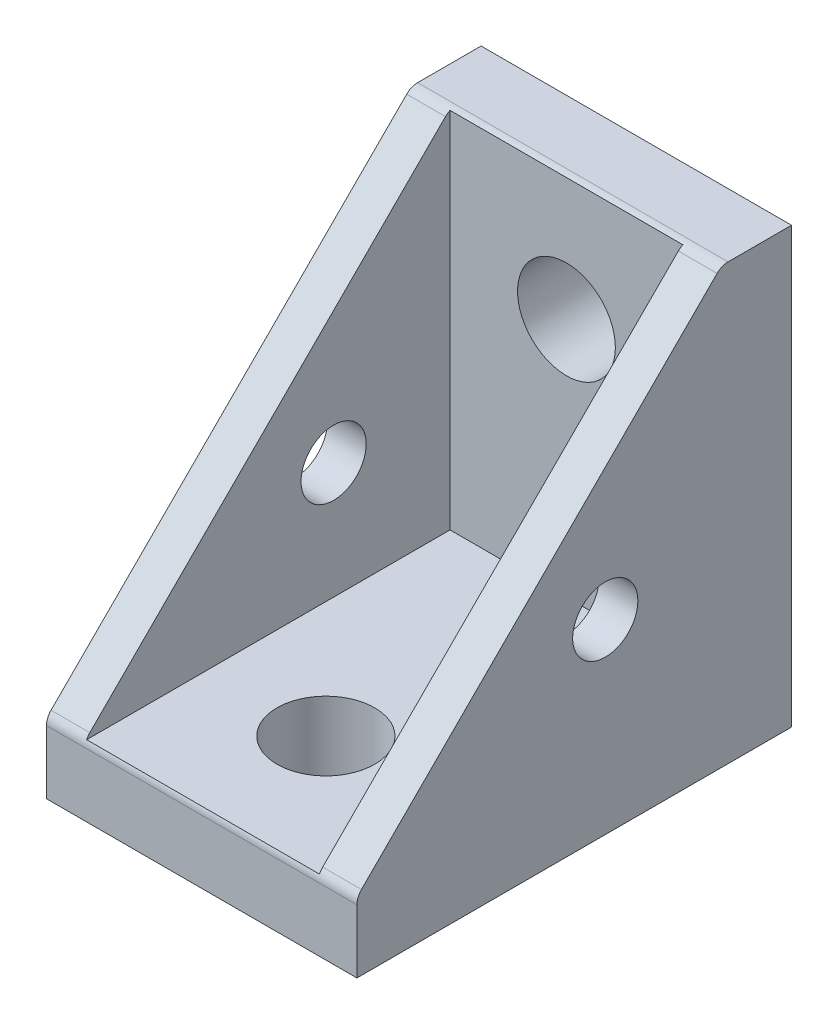
from build123d import *

# Parameters (mm, degrees)
ESTRUSIONE_ESTRUSIONE1_DEPTH = 2.5
SCHIZZO2_W                   = 15
SCHIZZO2_H                   = 23.5
ESTRUSIONE_ESTRUSIONE2_DEPTH = 23.5
SCHIZZO3_W                   = 17.5
SCHIZZO3_H                   = 23.5
ESTRUSIONE_ESTRUSIONE3_DEPTH = 4.5
SCHIZZO4_W                   = 17.5
SCHIZZO4_H                   = 28
ESTRUSIONE_ESTRUSIONE4_DEPTH = 4.5
SCHIZZO5_W                   = 15
SCHIZZO5_H                   = 23.5
TAGLIO_ESTRUSIONE1_DEPTH     = 23.5
ESTRUSIONE_ESTRUSIONE5_DEPTH = 2.5
SCHIZZO7_W                   = 8
SCHIZZO7_H                   = 2
ESTRUSIONE_ESTRUSIONE6_DEPTH = 1
SCHIZZO8_W                   = 8
SCHIZZO8_H                   = 2
ESTRUSIONE_ESTRUSIONE7_DEPTH = 1
SCHIZZO9_W                   = 8
SCHIZZO9_H                   = 2
ESTRUSIONE_ESTRUSIONE8_DEPTH = 1
SCHIZZO10_W                  = 8
SCHIZZO10_H                  = 2
ESTRUSIONE_ESTRUSIONE9_DEPTH = 1
FORO_6_3_6_3_1_D             = 6.3
FORO_6_3_6_3_1_DEPTH         = 5.5
FORO_6_3_6_3_2_D             = 6.3
FORO_6_3_6_3_2_DEPTH         = 5.5
RACCORDO1_R                  = 0.3
RACCORDO2_START              = -11
RACCORDO2_DEPTH              = 22
FORO_FILETTATO_M5_1_D        = 4.2


with BuildPart() as part:
    # Schizzo1 → Estrusione-Estrusione1 (new body)
    with BuildSketch(Plane(origin=(-10, 0, 0), x_dir=(0, -1, 0), z_dir=(-1, 0, 0))):
        with BuildLine():
            Line((-27.707106781, 4.792893219), (-28, 4.5))
            Line((-28, 4.5), (-4.5, 4.5))
            Line((-4.5, 4.5), (-4.5, 28))
            Line((-4.5, 28), (-4.792893219, 27.707106781))
            add(Edge.make_bspline(
                [(-4.792893219, 27.707106781), (-12.430964406, 20.069035594), (-20.069035594, 12.430964406), (-27.707106781, 4.792893219)],
                knots=[0, 0, 0, 0, 1, 1, 1, 1], degree=3))
        make_face()
    extrude(amount=-ESTRUSIONE_ESTRUSIONE1_DEPTH)

    # Schizzo2 → Estrusione-Estrusione2 (add)
    with BuildSketch(Plane(origin=(0, 0, 4.5), x_dir=(-1, 0, 0), z_dir=(0, 0, -1))):
        with Locations((0, 16.25)):
            Rectangle(SCHIZZO2_W, SCHIZZO2_H)
    extrude(amount=-ESTRUSIONE_ESTRUSIONE2_DEPTH)

    # Schizzo3 → Estrusione-Estrusione3 (add)
    with BuildSketch(Plane(origin=(0, 0, 4.5), x_dir=(-1, 0, 0), z_dir=(0, 0, -1))):
        with Locations((1.25, 16.25)):
            Rectangle(SCHIZZO3_W, SCHIZZO3_H)
    extrude(amount=ESTRUSIONE_ESTRUSIONE3_DEPTH)

    # Schizzo4 → Estrusione-Estrusione4 (add)
    with BuildSketch(Plane.XZ.offset(-4.5)):
        with Locations((-1.25, 14)):
            Rectangle(SCHIZZO4_W, SCHIZZO4_H)
    extrude(amount=ESTRUSIONE_ESTRUSIONE4_DEPTH)

    # Schizzo5 → Taglio-Estrusione1 (cut)
    with BuildSketch(Plane(origin=(0, 28, 0), x_dir=(-1, 0, 0), z_dir=(0, 1, 0))):
        with Locations((0, 16.25)):
            Rectangle(SCHIZZO5_W, SCHIZZO5_H)
    extrude(amount=-TAGLIO_ESTRUSIONE1_DEPTH, mode=Mode.SUBTRACT)

    # Schizzo6 → Estrusione-Estrusione5 (add)
    with BuildSketch(Plane(origin=(7.5, 0, 0), x_dir=(0, 0, -1), z_dir=(1, 0, 0))):
        with BuildLine():
            Line((-28, 0), (-28, 4.5))
            Line((-28, 4.5), (-27.707106492, 4.792893508))
            add(Edge.make_bspline(
                [(-4.792893219, 27.707106781), (-12.43096431, 20.06903569), (-20.069035401, 12.430964599), (-27.707106492, 4.792893508)],
                knots=[0, 0, 0, 0, 1, 1, 1, 1], degree=3))
            Line((-4.792893219, 27.707106781), (-4.5, 28))
            Line((-4.5, 28), (0, 28))
            Line((0, 28), (0, 0))
            Line((0, 0), (-28, 0))
        make_face()
    extrude(amount=ESTRUSIONE_ESTRUSIONE5_DEPTH)

    # Schizzo7 → Estrusione-Estrusione6 (add)
    with BuildSketch(Plane(origin=(0, 0, 0), x_dir=(-1, 0, 0), z_dir=(0, 0, -1))):
        with Locations((0, 5)):
            Rectangle(SCHIZZO7_W, SCHIZZO7_H)
    extrude(amount=ESTRUSIONE_ESTRUSIONE6_DEPTH)

    # Schizzo8 → Estrusione-Estrusione7 (add)
    with BuildSketch(Plane(origin=(0, 0, 0), x_dir=(-1, 0, 0), z_dir=(0, 0, -1))):
        with Locations((0, 24.5)):
            Rectangle(SCHIZZO8_W, SCHIZZO8_H)
    extrude(amount=ESTRUSIONE_ESTRUSIONE7_DEPTH)

    # Schizzo9 → Estrusione-Estrusione8 (add)
    with BuildSketch(Plane.XZ):
        with Locations((0, 24.5)):
            Rectangle(SCHIZZO9_W, SCHIZZO9_H)
    extrude(amount=ESTRUSIONE_ESTRUSIONE8_DEPTH)

    # Schizzo10 → Estrusione-Estrusione9 (add)
    with BuildSketch(Plane.XZ):
        with Locations((0, 5)):
            Rectangle(SCHIZZO10_W, SCHIZZO10_H)
    extrude(amount=ESTRUSIONE_ESTRUSIONE9_DEPTH)

    # Foro Ø6.3 (6.3)-1
    with Locations(Plane(origin=(0, 4.5, 0), x_dir=(1, 0, 0), z_dir=(0, 1, 0))):
        with Locations((0, -20)):
            Hole(FORO_6_3_6_3_1_D / 2, depth=FORO_6_3_6_3_1_DEPTH)

    # Foro Ø6.3 (6.3)-2
    with Locations(Plane.XY.offset(4.5)):
        with Locations((0, 20)):
            Hole(FORO_6_3_6_3_2_D / 2, depth=FORO_6_3_6_3_2_DEPTH)

    # Raccordo1
    raccordo1_edges = [part.edges().sort_by_distance(p)[0] for p in [
        (-4, 23.5, -0.5),
        (-4, 25.5, -0.5),
        (4, 25.5, -0.5),
        (4, 23.5, -0.5),
        (4, -0.5, 25.5),
        (-4, -0.5, 25.5),
        (-4, -0.5, 23.5),
        (4, -0.5, 23.5),
        (4, -0.5, 6),
        (-4, -0.5, 6),
        (-4, -0.5, 4),
        (4, -0.5, 4),
        (-4, 4, -0.5),
        (-4, 6, -0.5),
        (4, 6, -0.5),
        (4, 4, -0.5),
    ]]
    fillet(raccordo1_edges, radius=RACCORDO1_R)

    # Raccordo2: read off the stored shape, not the designer's step
    # Raccordo2 outline → Raccordo2 (cut)
    with BuildSketch(Plane.YZ.offset(RACCORDO2_START)):
        with BuildLine():
            ThreePointArc((4.5, 27.910179721), (4.655566811, 27.82179701), (4.792893508, 27.707106492))
            Line((4.792893508, 27.707106492), (4.5, 28))
            Line((4.5, 28), (4.5, 27.910179721))
        make_face()
        with BuildLine():
            ThreePointArc((4.085786438, 28), (4.297706563, 27.97728699), (4.5, 27.910179721))
            Line((4.5, 27.910179721), (4.5, 28))
            Line((4.5, 28), (4.085786438, 28))
        make_face()
        with BuildLine():
            Line((28, 4.5), (27.707106781, 4.792893219))
            ThreePointArc((27.707106781, 4.792893219), (27.821797127, 4.655566644), (27.910179722, 4.5))
            Line((27.910179722, 4.5), (28, 4.5))
        make_face()
        with BuildLine():
            Line((28, 4.5), (27.910179722, 4.5))
            ThreePointArc((27.910179722, 4.5), (27.97728699, 4.297706563), (28, 4.085786438))
            Line((28, 4.085786438), (28, 4.5))
        make_face()
    extrude(amount=RACCORDO2_DEPTH, mode=Mode.SUBTRACT)

    # Foro filettato M5-1 (through all)
    with Locations(Plane(origin=(10, 12, 12), x_dir=(0, 0, 1), z_dir=(1, 0, 0))):
        with Locations((0, 0)):
            Hole(FORO_FILETTATO_M5_1_D / 2)


solid = part.part
